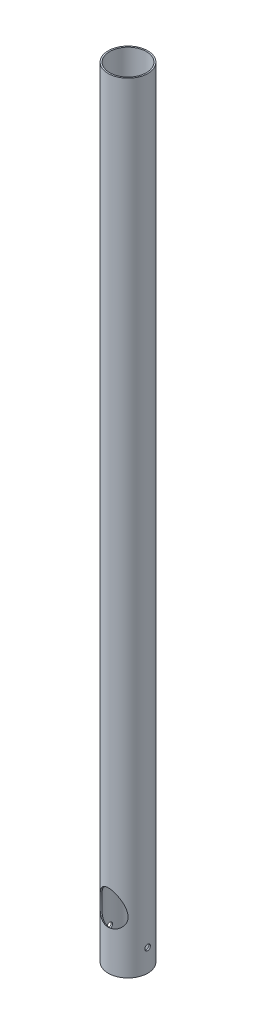
from build123d import *

# Parameters (mm, degrees)
EXTRUDE_1_OUTLINE_R      = 70.5
EXTRUDE_1_OUTLINE_R_2    = 65.5
EXTRUDE_1_DEPTH          = 2781
CUT_EXTRUDE_3_DEPTH      = 2783.786642917
CUT_EXTRUDE_3_DEPTH_BACK = 2783.786642917
SKETCH_6_R               = 10
SKETCH_7_R               = 50
CUT_EXTRUDE_4_DEPTH      = 200
SKETCH_13_R              = 52.5
CUT_EXTRUDE_8_DEPTH      = 200


# Read off the part's stored shape, not the designer's step: Вытянуть-Тонкостенный1
with BuildPart() as part:
    # Вытянуть-Тонкостенный1 outline → Вытянуть-Тонкостенный1 (new body)
    with BuildSketch(Plane(origin=(0, 0, 0), x_dir=(1, 0, 0), z_dir=(0, 1, 0))):
        Circle(EXTRUDE_1_OUTLINE_R)
        Circle(EXTRUDE_1_OUTLINE_R_2, mode=Mode.SUBTRACT)
    extrude(amount=EXTRUDE_1_DEPTH)

    # Эскиз6 → Вырез-Вытянуть3 (cut, two sides: drawn at the far end of the back side and taken through both)
    with BuildSketch(Plane(origin=(0, 0, 0), x_dir=(0, 0, -1), z_dir=(1, 0, 0)).offset(-CUT_EXTRUDE_3_DEPTH_BACK)):
        with Locations((0, 80)):
            Circle(SKETCH_6_R)
    extrude(amount=CUT_EXTRUDE_3_DEPTH + CUT_EXTRUDE_3_DEPTH_BACK, mode=Mode.SUBTRACT)

    # Эскиз7 → Вырез-Вытянуть4 (cut)
    with BuildSketch(Plane(origin=(0, 176.689515805, 252.338779809), x_dir=(1, 0, 0), z_dir=(0, -0.5735764363510416, -0.8191520442889949))):
        with Locations(Location((0, -126.118813858, 0), (0, 0, 90))):
            Circle(SKETCH_7_R)
    extrude(amount=CUT_EXTRUDE_4_DEPTH, mode=Mode.SUBTRACT)

    # Эскиз13 → Вырез-Вытянуть8 (cut)
    with BuildSketch(Plane(origin=(0, 750.265952156, 1071.490824098), x_dir=(1, 0, 0), z_dir=(0, -0.5735764363510416, -0.8191520442889949))):
        with Locations(Location((0, -2185, 0), (0, 0, 270))):
            Circle(SKETCH_13_R)
    extrude(amount=-CUT_EXTRUDE_8_DEPTH, mode=Mode.SUBTRACT)


solid = part.part
